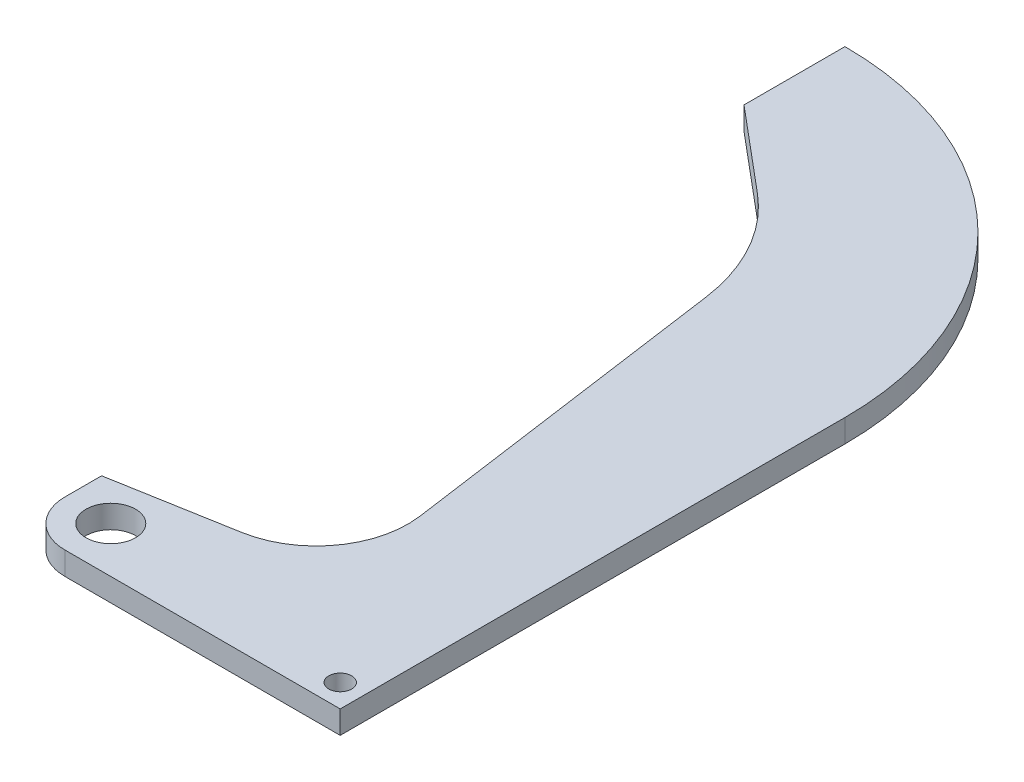
from build123d import *

# Parameters (mm, degrees)
SKETCH1_R           = 3.429
SKETCH1_R_2         = 1.5875
BOSS_EXTRUDE1_DEPTH = 3.175
CUT_EXTRUDE1_DEPTH  = 123.679962198
FILLET1_R           = 6.35


with BuildPart() as part:
    # Sketch1 → Boss-Extrude1 (new body)
    with BuildSketch(Plane(origin=(0, 0, 0), x_dir=(1, 0, 0), z_dir=(0, 1, 0))):
        with BuildLine():
            Line((0, 0), (44.45, 0))
            Line((44.45, 0), (44.45, 69.85))
            ThreePointArc((44.45, 69.85), (31.430896424, 101.280896424), (0, 114.3))
            Line((0, 114.3), (0, 0))
        make_face()
        with Locations((6.35, 6.35)):
            Circle(SKETCH1_R, mode=Mode.SUBTRACT)
        with Locations((41.275, 3.175)):
            Circle(SKETCH1_R_2, mode=Mode.SUBTRACT)
    extrude(amount=BOSS_EXTRUDE1_DEPTH)

    # Sketch2 → Cut-Extrude1 (cut, through all)
    with BuildSketch(Plane(origin=(0, 3.175, 0), x_dir=(1, 0, 0), z_dir=(0, 1, 0))):
        with BuildLine():
            Line((16.499594236, 14.339323634), (0, 11.43))
            Line((0, 11.43), (0, 100.33))
            Line((0, 100.33), (11.578626407, 90.614378852))
            ThreePointArc((11.578626407, 90.614378852), (17.468445655, 83.468697719), (20.405366763, 74.686600928))
            Line((20.405366763, 74.686600928), (26.8710352, 28.611257563))
            ThreePointArc((26.8710352, 28.611257563), (24.567999732, 19.380438031), (16.499594236, 14.339323634))
        make_face()
    extrude(amount=-CUT_EXTRUDE1_DEPTH, mode=Mode.SUBTRACT)

    # Fillet1
    fillet1_edges = [part.edges().sort_by_distance(p)[0] for p in [
        (0, 1.5875, 0),
    ]]
    fillet(fillet1_edges, radius=FILLET1_R)


solid = part.part
